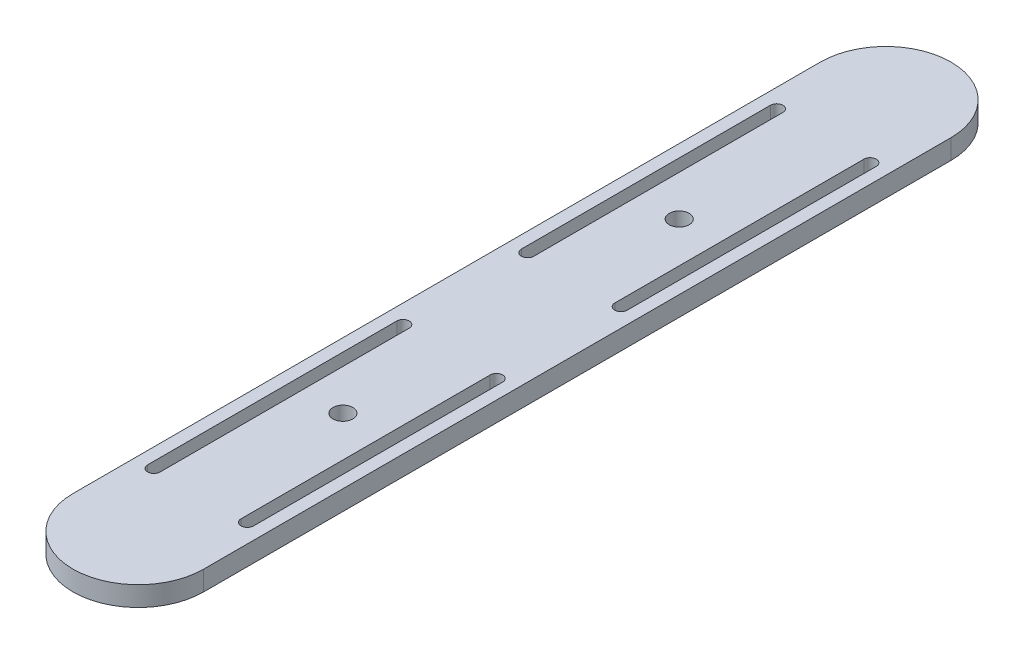
from build123d import *

# Parameters (mm, degrees)
BOSS_EXTRUDE1_DEPTH     = 3.175
CUT_EXTRUDE2_DEPTH      = 131.960225355
CUT_EXTRUDE2_DEPTH_BACK = 131.960225355
CUT_EXTRUDE3_DEPTH      = 131.960225355
CUT_EXTRUDE3_DEPTH_BACK = 131.960225355
SKETCH4_R               = 1.6


with BuildPart() as part:
    # Sketch1 → Boss-Extrude1 (new body)
    with BuildSketch(Plane(origin=(0, 0, 0), x_dir=(1, 0, 0), z_dir=(0, 1, 0))):
        with BuildLine():
            Line((-10.5, 0), (-10.5, -120))
            ThreePointArc((-10.5, -120), (0, -130.5), (10.5, -120))
            Line((10.5, -120), (10.5, 0))
            ThreePointArc((10.5, 0), (0, 10.5), (-10.5, 0))
        make_face()
    extrude(amount=BOSS_EXTRUDE1_DEPTH)

    # Sketch3 → Cut-Extrude2 (cut, two sides: drawn at the far end of the back side and taken through both)
    with BuildSketch(Plane.XZ.offset(-CUT_EXTRUDE2_DEPTH_BACK)):
        with BuildLine():
            Line((-8.5, 110), (-8.5, 70))
            ThreePointArc((-8.5, 70), (-7.5, 69), (-6.5, 70))
            Line((-6.5, 70), (-6.5, 110))
            ThreePointArc((-6.5, 110), (-7.5, 111), (-8.5, 110))
        make_face()
        with BuildLine():
            Line((6.5, 110), (6.5, 70))
            ThreePointArc((6.5, 70), (7.5, 69), (8.5, 70))
            Line((8.5, 70), (8.5, 110))
            ThreePointArc((8.5, 110), (7.5, 111), (6.5, 110))
        make_face()
        with BuildLine():
            Line((8.5, 10), (8.5, 50))
            ThreePointArc((8.5, 50), (7.5, 51), (6.5, 50))
            Line((6.5, 50), (6.5, 10))
            ThreePointArc((6.5, 10), (7.5, 9), (8.5, 10))
        make_face()
        with BuildLine():
            Line((-8.5, 50), (-8.5, 10))
            ThreePointArc((-8.5, 10), (-7.5, 9), (-6.5, 10))
            Line((-6.5, 10), (-6.5, 50))
            ThreePointArc((-6.5, 50), (-7.5, 51), (-8.5, 50))
        make_face()
    extrude(amount=CUT_EXTRUDE2_DEPTH + CUT_EXTRUDE2_DEPTH_BACK, mode=Mode.SUBTRACT)

    # Sketch4 → Cut-Extrude3 (cut, two sides: drawn at the far end of the back side and taken through both)
    with BuildSketch(Plane(origin=(0, 3.175, 0), x_dir=(1, 0, 0), z_dir=(0, 1, 0)).offset(-CUT_EXTRUDE3_DEPTH_BACK)):
        with Locations((0, -33.15)):
            Circle(SKETCH4_R)
        with Locations((0, -87.15)):
            Circle(SKETCH4_R)
    extrude(amount=CUT_EXTRUDE3_DEPTH + CUT_EXTRUDE3_DEPTH_BACK, mode=Mode.SUBTRACT)


solid = part.part
